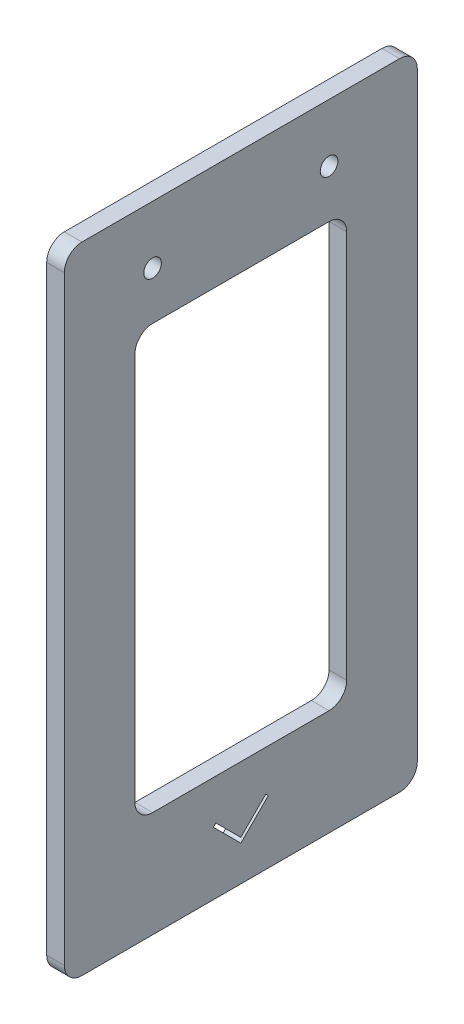
from build123d import *

# Parameters (mm, degrees)
BOSS_EXTRUDE2_DEPTH     = 6.35
CUT_EXTRUDE1_REACH      = 132.909
CUT_EXTRUDE2_DEPTH      = 131.908603613
CUT_EXTRUDE2_DEPTH_BACK = 131.908603613
SKETCH5_R               = 3.175


with BuildPart() as part:
    # Sketch3 → Boss-Extrude2 (new body)
    with BuildSketch(Plane(origin=(0, 0, 0), x_dir=(0, 0, -1), z_dir=(1, 0, 0))):
        with BuildLine():
            Line((-57.15, -114.3), (57.15, -114.3))
            ThreePointArc((57.15, -114.3), (61.640128061, -112.440128061), (63.5, -107.95))
            Line((63.5, -107.95), (63.5, 107.95))
            ThreePointArc((63.5, 107.95), (61.640128061, 112.440128061), (57.15, 114.3))
            Line((57.15, 114.3), (-57.15, 114.3))
            ThreePointArc((-57.15, 114.3), (-61.640128061, 112.440128061), (-63.5, 107.95))
            Line((-63.5, 107.95), (-63.5, -107.95))
            ThreePointArc((-63.5, -107.95), (-61.640128061, -112.440128061), (-57.15, -114.3))
        make_face()
        with BuildLine():
            Line((-31.75, -76.2), (31.75, -76.2))
            ThreePointArc((31.75, -76.2), (36.240128061, -74.340128061), (38.1, -69.85))
            Line((38.1, -69.85), (38.1, 69.85))
            ThreePointArc((38.1, 69.85), (36.240128061, 74.340128061), (31.75, 76.2))
            Line((31.75, 76.2), (-31.75, 76.2))
            ThreePointArc((-31.75, 76.2), (-36.240128061, 74.340128061), (-38.1, 69.85))
            Line((-38.1, 69.85), (-38.1, -69.85))
            ThreePointArc((-38.1, -69.85), (-36.240128061, -74.340128061), (-31.75, -76.2))
        make_face(mode=Mode.SUBTRACT)
    extrude(amount=BOSS_EXTRUDE2_DEPTH)

    # Sketch4 → Cut-Extrude1 (cut, up to next)
    with BuildSketch(Plane(origin=(6.35, 0, 0), x_dir=(0, 0, -1), z_dir=(1, 0, 0)), mode=Mode.PRIVATE) as cut_extrude1_sk1:
        Polygon((0, -99.803948776), (-8.980256121, -90.823692655), (-9.878281733, -91.721718267), (0, -101.6), (9.878281733, -91.721718267), (8.980256121, -90.823692655), align=None)
    cut_extrude1_tool1 = extrude(cut_extrude1_sk1.sketch, amount=-CUT_EXTRUDE1_REACH, mode=Mode.PRIVATE) & part.part
    add(cut_extrude1_tool1.solids().sort_by_distance((6.35, -95.472951, 4.649259))[0], mode=Mode.SUBTRACT)

    # Sketch5 → Cut-Extrude2 (cut, two sides: drawn at the far end of the back side and taken through both)
    with BuildSketch(Plane(origin=(6.35, 0, 0), x_dir=(0, 0, -1), z_dir=(1, 0, 0)).offset(-CUT_EXTRUDE2_DEPTH_BACK)):
        with Locations((-31.75, 93.472)):
            Circle(SKETCH5_R)
        with Locations((31.75, 93.472)):
            Circle(SKETCH5_R)
    extrude(amount=CUT_EXTRUDE2_DEPTH + CUT_EXTRUDE2_DEPTH_BACK, mode=Mode.SUBTRACT)


solid = part.part
